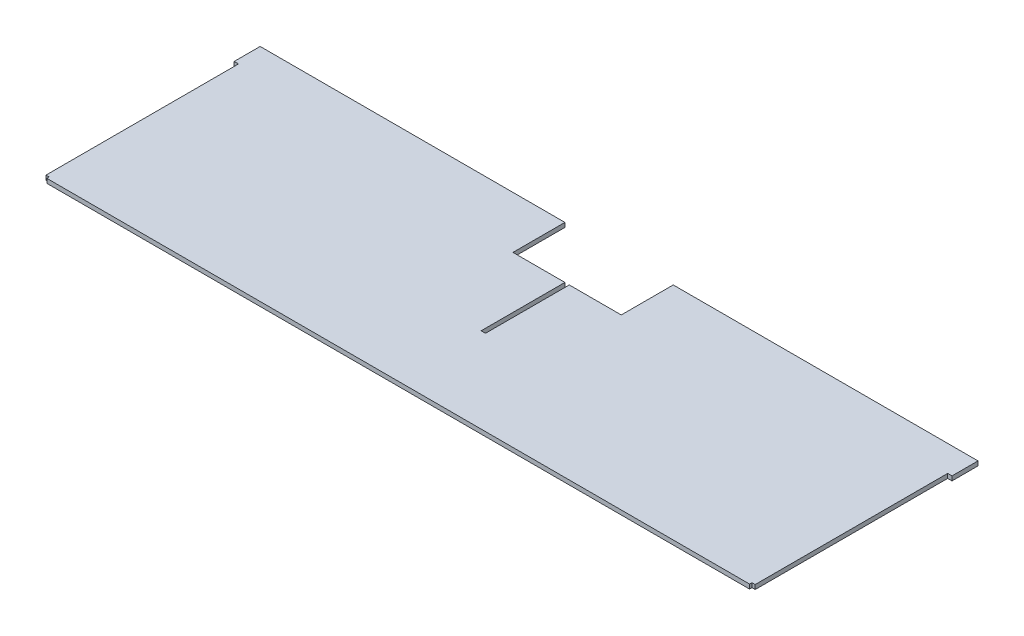
from build123d import *

# Parameters (mm, degrees)
BOSS_EXTRUDE1_DEPTH = 3.2
SKETCH11_W          = 3.2
SKETCH11_H          = 199.000000018
CUT_EXTRUDE1_DEPTH  = 284.232260808
SKETCH13_W          = 38.1
SKETCH13_H          = 38.1
CUT_EXTRUDE3_DEPTH  = 284.232260808
SKETCH15_W          = 3.175
SKETCH15_H          = 141.090166638
SKETCH15_H_2        = 141.087880638
CUT_EXTRUDE5_DEPTH  = 284.232260808


with BuildPart() as part:
    # Sketch1 → Boss-Extrude1 (new body)
    with BuildSketch(Plane(origin=(0, 0, 0), x_dir=(1, 0, 0), z_dir=(0, 1, 0))):
        Polygon((265.160373285, -60.637626629), (259.623773233, -60.637626629), (259.623773233, -62.400000041), (-255.462493265, -62.400000041), (-255.462493265, -60.637626629), (-260.999093317, -60.637626629), (-260.999093317, 99.500000009), (265.160373285, 99.500000009), align=None)
    extrude(amount=BOSS_EXTRUDE1_DEPTH)

    # Sketch11 → Cut-Extrude1 (cut, through all)
    with BuildSketch(Plane(origin=(0, 3.2, 0), x_dir=(1, 0, 0), z_dir=(0, 1, 0))):
        with Locations((2.080639984, 99.500000009)):
            Rectangle(SKETCH11_W, SKETCH11_H)
    extrude(amount=-CUT_EXTRUDE1_DEPTH, mode=Mode.SUBTRACT)

    # Sketch13 → Cut-Extrude3 (cut, through all)
    with BuildSketch(Plane(origin=(0, 3.2, 0), x_dir=(1, 0, 0), z_dir=(0, 1, 0))):
        with Locations((-18.569360016, 80.450000009)):
            Rectangle(SKETCH13_W, SKETCH13_H)
        with Locations((22.730639984, 80.450000009)):
            Rectangle(SKETCH13_W, SKETCH13_H)
    extrude(amount=-CUT_EXTRUDE3_DEPTH, mode=Mode.SUBTRACT)

    # Sketch15 → Cut-Extrude5 (cut, through all)
    with BuildSketch(Plane(origin=(0, 3.2, 0), x_dir=(1, 0, 0), z_dir=(0, 1, 0))):
        with Locations((-259.411593317, 9.90745669)):
            Rectangle(SKETCH15_W, SKETCH15_H)
        with Locations((263.572873285, 9.90631369)):
            Rectangle(SKETCH15_W, SKETCH15_H_2)
    extrude(amount=-CUT_EXTRUDE5_DEPTH, mode=Mode.SUBTRACT)


solid = part.part
